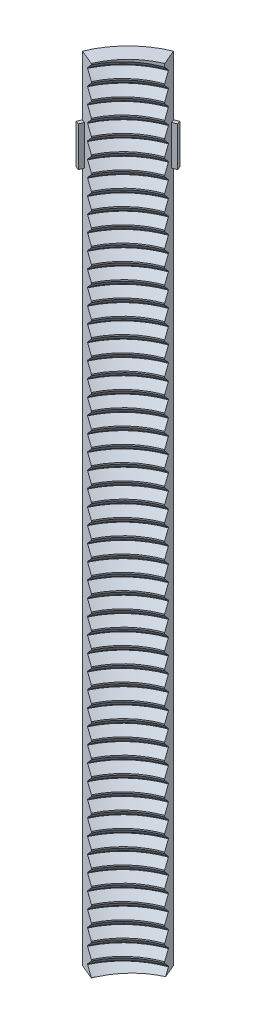
from build123d import *

# Parameters (mm, degrees)
EXTRUDE_1_DEPTH     = 400
EXTRUDE_2_DEPTH     = 20
SWEEP_1_PITCH       = 8
CUT_EXTRUDE_START   = -30
CUT_EXTRUDE_1_DEPTH = 370
SKETCH_9_R          = 1.25
CUT_EXTRUDE_2_DEPTH = 3.5


with BuildPart() as part:
    # 草图1 → 凸台-拉伸1 (new body)
    with BuildSketch(Plane(origin=(0, -839.327995916, 0), x_dir=(1, 0, 0), z_dir=(0, 1, 0))):
        with BuildLine():
            Line((-13.087773387, 31.596680012), (-16.264045876, 39.264880132))
            ThreePointArc((-16.264045876, 39.264880132), (-30.0520382, 30.0520382), (-39.264880132, 16.264045876))
            Line((-39.264880132, 16.264045876), (-31.596680012, 13.087773387))
            ThreePointArc((-31.596680012, 13.087773387), (-24.183051917, 24.183051917), (-13.087773387, 31.596680012))
        make_face()
    extrude(amount=-EXTRUDE_1_DEPTH)

    # 草图3 → 凸台-拉伸2 (add)
    with BuildSketch(Plane(origin=(0, -869.327995916, 0), x_dir=(1, 0, 0), z_dir=(0, 1, 0))):
        with BuildLine():
            Line((-38.436118269, 13.384872522), (-40.135995735, 13.976832486))
            ThreePointArc((-40.135995735, 13.976832486), (-39.716905826, 15.126711197), (-39.264880132, 16.264045876))
            Line((-39.264880132, 16.264045876), (-37.601896973, 15.575215697))
            ThreePointArc((-37.601896973, 15.575215697), (-38.03477805, 14.486050487), (-38.436118269, 13.384872522))
        make_face()
        with BuildLine():
            Line((-13.384872522, 38.436118269), (-13.976832486, 40.135995735))
            ThreePointArc((-13.976832486, 40.135995735), (-15.126711197, 39.716905826), (-16.264045876, 39.264880132))
            Line((-16.264045876, 39.264880132), (-15.575215697, 37.601896973))
            ThreePointArc((-15.575215697, 37.601896973), (-14.486050487, 38.03477805), (-13.384872522, 38.436118269))
        make_face()
    extrude(amount=-EXTRUDE_2_DEPTH)

    # 切除-扫描1: the profile of 草图6 screwed along a right-hand helix of 49.53125 turns, 14 arcs to a turn; built about Z, then put on its axis
    sweep_1_z = Axis((0, 0, 0), (0, 0, 1))
    sweep_1_corners = [(34.1, 0, -3.75), (34.1, 0, 3.75), (37.7, 0, 0.15), (37.7, 0, -0.15)]
    with BuildLine(mode=Mode.PRIVATE) as sweep_1_profile:
        Line(sweep_1_corners[0], sweep_1_corners[1])
        Line(sweep_1_corners[1], sweep_1_corners[2])
        Line(sweep_1_corners[2], sweep_1_corners[3])
        Line(sweep_1_corners[3], sweep_1_corners[0])
    sweep_1_cap = Face(sweep_1_profile.wire())
    sweep_1_turn_angles = [0, 12.857142857, 25.714285714, 38.571428571, 51.428571429, 64.285714286, 77.142857143, 90, 102.857142857, 115.714285714, 128.571428571, 141.428571429, 154.285714286, 167.142857143, 180, 192.857142857, 205.714285714, 218.571428571, 231.428571429, 244.285714286, 257.142857143, 270, 282.857142857, 295.714285714, 308.571428571, 321.428571429, 334.285714286, 347.142857143, 360, 372.857142857, 385.714285714, 398.571428571, 411.428571429, 424.285714286, 437.142857143, 450, 462.857142857, 475.714285714, 488.571428571, 501.428571429, 514.285714286, 527.142857143, 540, 552.857142857, 565.714285714, 578.571428571, 591.428571429, 604.285714286, 617.142857143, 630, 642.857142857, 655.714285714, 668.571428571, 681.428571429, 694.285714286, 707.142857143, 720]
    sweep_1_turn_weights = [1, 0.9749279121818236, 1, 0.9749279121818236, 1, 0.9749279121818236, 1, 0.9749279121818236, 1, 0.9749279121818236, 1, 0.9749279121818236, 1, 0.9749279121818236, 1, 0.9749279121818236, 1, 0.9749279121818236, 1, 0.9749279121818236, 1, 0.9749279121818236, 1, 0.9749279121818237, 1, 0.9749279121818236, 1, 0.9749279121818236, 1, 0.9749279121818236, 1, 0.9749279121818236, 1, 0.9749279121818236, 1, 0.9749279121818236, 1, 0.9749279121818236, 1, 0.9749279121818236, 1, 0.9749279121818237, 1, 0.9749279121818235, 1, 0.9749279121818237, 1, 0.9749279121818237, 1, 0.9749279121818235, 1, 0.9749279121818237, 1, 0.9749279121818235, 1, 0.9749279121818237, 1]
    sweep_1_turn_rails = [Edge.make_bspline([Vector(p[0], p[1], 0).rotate(sweep_1_z, sweep_1_turn_angles[k]) / sweep_1_turn_weights[k] + Vector(0, 0, p[2] + SWEEP_1_PITCH * sweep_1_turn_angles[k] / 360) for k in range(57)], [0, 0, 0, 1, 1, 2, 2, 3, 3, 4, 4, 5, 5, 6, 6, 7, 7, 8, 8, 9, 9, 10, 10, 11, 11, 12, 12, 13, 13, 14, 14, 15, 15, 16, 16, 17, 17, 18, 18, 19, 19, 20, 20, 21, 21, 22, 22, 23, 23, 24, 24, 25, 25, 26, 26, 27, 27, 28, 28, 28], 2, sweep_1_turn_weights) for p in sweep_1_corners]
    sweep_1_turn_sides = [Face.make_surface_from_curves(sweep_1_turn_rails[p[0]], sweep_1_turn_rails[p[1]]) for p in [(0, 1), (1, 2), (2, 3), (3, 0)]]
    sweep_1_last_angles = [17280, 17292.857142857, 17305.714285714, 17318.571428571, 17331.428571429, 17344.285714286, 17357.142857143, 17370, 17382.857142857, 17395.714285714, 17408.571428571, 17421.428571429, 17434.285714286, 17447.142857143, 17460, 17472.857142857, 17485.714285714, 17498.571428571, 17511.428571429, 17524.285714286, 17537.142857143, 17550, 17562.857142857, 17575.714285714, 17588.571428571, 17601.428571429, 17614.285714286, 17627.142857143, 17640, 17652.857142857, 17665.714285714, 17678.571428571, 17691.428571429, 17704.285714286, 17717.142857143, 17730, 17742.857142857, 17755.714285714, 17768.571428571, 17781.428571429, 17794.285714286, 17807.142857143, 17820, 17825.625, 17831.25]
    sweep_1_last_weights = [1, 0.9749279121818226, 1, 0.9749279121818226, 1, 0.9749279121818226, 1, 0.9749279121818296, 1, 0.9749279121818226, 1, 0.9749279121818226, 1, 0.9749279121818226, 1, 0.9749279121818226, 1, 0.9749279121818226, 1, 0.9749279121818226, 1, 0.9749279121818296, 1, 0.9749279121818226, 1, 0.9749279121818226, 1, 0.9749279121818226, 1, 0.9749279121818226, 1, 0.9749279121818226, 1, 0.9749279121818226, 1, 0.9749279121818296, 1, 0.9749279121818226, 1, 0.9749279121818226, 1, 0.9749279121818226, 1, 0.995184726672172, 1]
    sweep_1_last_rails = [Edge.make_bspline([Vector(p[0], p[1], 0).rotate(sweep_1_z, sweep_1_last_angles[k]) / sweep_1_last_weights[k] + Vector(0, 0, p[2] + SWEEP_1_PITCH * sweep_1_last_angles[k] / 360) for k in range(45)], [0, 0, 0, 1, 1, 2, 2, 3, 3, 4, 4, 5, 5, 6, 6, 7, 7, 8, 8, 9, 9, 10, 10, 11, 11, 12, 12, 13, 13, 14, 14, 15, 15, 16, 16, 17, 17, 18, 18, 19, 19, 20, 20, 21, 21, 22, 22, 22], 2, sweep_1_last_weights) for p in sweep_1_corners]
    sweep_1_last_sides = [Face.make_surface_from_curves(sweep_1_last_rails[p[0]], sweep_1_last_rails[p[1]]) for p in [(0, 1), (1, 2), (2, 3), (3, 0)]]
    sweep_1 = Plane(origin=(0, -843.077995916, 0), x_dir=(-1, 0, 0), z_dir=(0, -1, 0)) * Solid(Shell([*[p.moved(Location((0, 0, 2 * SWEEP_1_PITCH * i))) for i in range(24) for p in sweep_1_turn_sides], *sweep_1_last_sides, sweep_1_cap, sweep_1_cap.rotate(sweep_1_z, 17831.25).moved(Location((0, 0, SWEEP_1_PITCH * 17831.25 / 360)))]))
    add(sweep_1, mode=Mode.SUBTRACT)

    # 草图8 → 切除-拉伸1 (cut)
    with BuildSketch(Plane(origin=(0, -839.327995916, 0), x_dir=(1, 0, 0), z_dir=(0, 1, 0)).offset(CUT_EXTRUDE_START)):
        with BuildLine():
            Line((-33.92762491, 25.84451137), (-31.309541338, 23.835585187))
            ThreePointArc((-31.309541338, 23.835585187), (-27.82465184, 27.82465184), (-23.835585187, 31.309541338))
            Line((-23.835585187, 31.309541338), (-25.84451137, 33.92762491))
            ThreePointArc((-25.84451137, 33.92762491), (-30.158104218, 30.158104218), (-33.92762491, 25.84451137))
        make_face()
    extrude(amount=-CUT_EXTRUDE_1_DEPTH, mode=Mode.SUBTRACT)

    # 草图9 → 切除-拉伸2 (cut)
    with BuildSketch(Plane(origin=(-30.0520382, 0, -30.0520382), x_dir=(0, 1, 0), z_dir=(-0.7071067811865516, 0, -0.7071067811865436))):
        with Locations(Location((-859.327995916, 0, 0), (0, 0, 270))):
            Circle(SKETCH_9_R)
    extrude(amount=-CUT_EXTRUDE_2_DEPTH, mode=Mode.SUBTRACT)


solid = part.part
